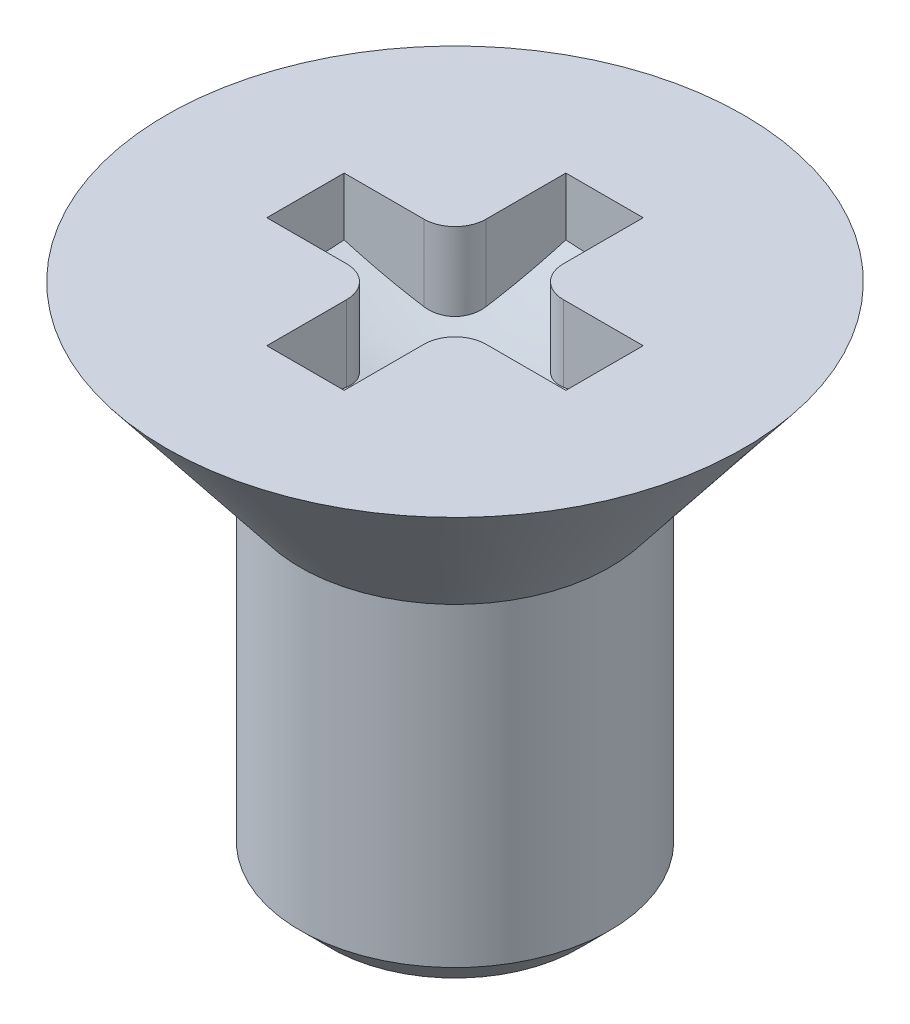
from build123d import *

# Parameters (mm, degrees)
CUT_EXTRUDE1_START = -0.8250001
CUT_EXTRUDE1_DEPTH = 0.8250001
FILLET1_R          = 0.3
CHAMFER1_SIZE      = 0.3


with BuildPart() as part:
    # Sketch1 → Revolve1 (revolve)
    with BuildSketch(Plane.XY, mode=Mode.PRIVATE) as revolve1_sk:
        Polygon((0, 0), (2.8, 0), (1.5, -1.65), (1.5, -5), (0, -5), align=None)
    revolve(revolve1_sk.sketch.rotate(Axis((0, 0, 0), (0, 1, 0)), 90), axis=Axis((0, 0, 0), (0, 1, 0)))

    # Cut-Extrude1: read off the stored shape, not the designer's step
    # Cut-Extrude1 outline → Cut-Extrude1 (cut)
    with BuildSketch(Plane(origin=(0, 0, 0), x_dir=(1, 0, 0), z_dir=(0, 1, 0)).offset(CUT_EXTRUDE1_START)):
        Polygon((-0.375, -1.45), (0.375, -1.45), (0.375, -0.375), (1.45, -0.375), (1.45, 0.375), (0.375, 0.375), (0.375, 1.45), (-0.375, 1.45), (-0.375, 0.375), (-1.45, 0.375), (-1.45, -0.375), (-0.375, -0.375), align=None)
    extrude(amount=CUT_EXTRUDE1_DEPTH, mode=Mode.SUBTRACT)

    # Cut-Extrude1 2 outline → Cut-Extrude1 2 (revolve)
    with BuildSketch(Plane.XY):
        with BuildLine():
            Line((1.49770658, -0.8250001), (1.497706581, -0.56115653))
            add(Edge.make_bspline(
                [(1.497706581, -0.56115653), (0.764803357, -0.783618763), (0, -0.825)],
                knots=[1.276099011, 1.276099011, 1.276099011, 1.516742006, 1.516742006, 1.516742006], degree=2, weights=[1, 0.992770097, 1]))
            Line((0, -0.825), (1.49770658, -0.8250001))
        make_face()
    revolve(axis=Axis((0, 0, 0), (0, 1, 0)))

    # Fillet1
    fillet1_edges = [part.edges().sort_by_distance(p)[0] for p in [
        (0.375, -0.38693388, 0.375),
        (-0.375, -0.38693388, -0.375),
        (0.375, -0.38693388, -0.375),
        (-0.375, -0.38693388, 0.375),
    ]]
    fillet(fillet1_edges, radius=FILLET1_R)

    # Chamfer1
    chamfer1_edges = [part.edges().sort_by_distance(p)[0] for p in [
        (0, -5, 1.5),
    ]]
    chamfer(chamfer1_edges, length=CHAMFER1_SIZE)


solid = part.part
